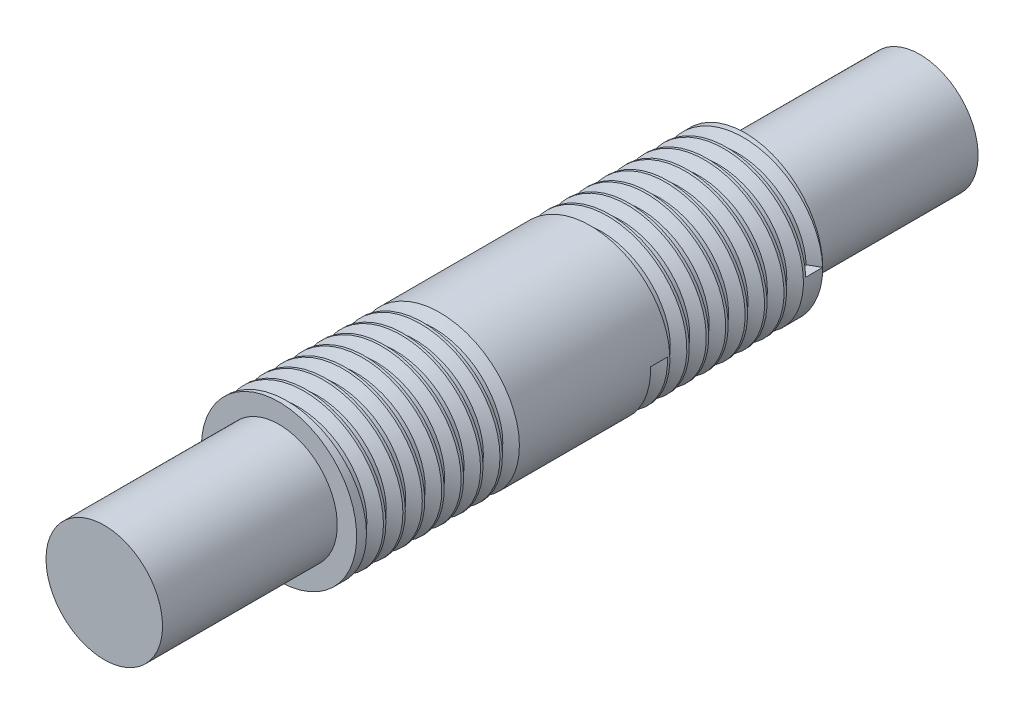
from build123d import *

# Parameters (mm, degrees)
SKETCH1_R           = 4
BOSS_EXTRUDE1_DEPTH = 12
SKETCH2_R           = 3
BOSS_EXTRUDE2_DEPTH = 21
THREAD1_PITCH       = 1
THREAD2_PITCH       = 1


with BuildPart() as part:
    # Sketch1 → Boss-Extrude1 (new, symmetric)
    with BuildSketch(Plane.XY):
        Circle(SKETCH1_R)
    extrude(amount=BOSS_EXTRUDE1_DEPTH, both=True)

    # Sketch2 → Boss-Extrude2 (add, symmetric)
    with BuildSketch(Plane.XY):
        with Locations(Location((0, 0, 0), (0, 0, 180))):
            Circle(SKETCH2_R)
    extrude(amount=BOSS_EXTRUDE2_DEPTH, both=True)

    # Thread1: the profile of Thread Profile1 profile screwed along a right-hand helix of 8 turns, 8 arcs to a turn; built about Z, then put on its axis
    thread1_z = Axis((0, 0, 0), (0, 0, 1))
    thread1_corners = [(4.0003, 0, -0.000173205), (4.0003, 0, 0.875173202), (3.458734125, 0, 0.562499999), (3.458734125, 0, 0.312499999)]
    with BuildLine(mode=Mode.PRIVATE) as thread1_profile:
        Line(thread1_corners[0], thread1_corners[1])
        Line(thread1_corners[1], thread1_corners[2])
        Line(thread1_corners[2], thread1_corners[3])
        Line(thread1_corners[3], thread1_corners[0])
    thread1_cap = Face(thread1_profile.wire())
    thread1_turn_angles = [0, 22.5, 45, 67.5, 90, 112.5, 135, 157.5, 180, 202.5, 225, 247.5, 270, 292.5, 315, 337.5, 360]
    thread1_turn_weights = [1, 0.9238795325112867, 1, 0.9238795325112867, 1, 0.9238795325112867, 1, 0.9238795325112867, 1, 0.9238795325112867, 1, 0.9238795325112867, 1, 0.9238795325112867, 1, 0.9238795325112867, 1]
    thread1_turn_rails = [Edge.make_bspline([Vector(p[0], p[1], 0).rotate(thread1_z, thread1_turn_angles[k]) / thread1_turn_weights[k] + Vector(0, 0, p[2] + THREAD1_PITCH * thread1_turn_angles[k] / 360) for k in range(17)], [0, 0, 0, 1, 1, 2, 2, 3, 3, 4, 4, 5, 5, 6, 6, 7, 7, 8, 8, 8], 2, thread1_turn_weights) for p in thread1_corners]
    thread1_turn_sides = [Face.make_surface_from_curves(thread1_turn_rails[p[0]], thread1_turn_rails[p[1]]) for p in [(0, 1), (1, 2), (2, 3), (3, 0)]]
    thread1 = Plane(origin=(0, 0, 12), x_dir=(-1, 0, 0), z_dir=(0, 0, -1)) * Solid(Shell([*[p.moved(Location((0, 0, THREAD1_PITCH * i))) for i in range(8) for p in thread1_turn_sides], thread1_cap, thread1_cap.rotate(thread1_z, 2880).moved(Location((0, 0, THREAD1_PITCH * 2880 / 360)))]))
    add(thread1, mode=Mode.SUBTRACT)

    # Thread2: the profile of Thread Profile2 profile screwed along a right-hand helix of 8 turns, 8 arcs to a turn; built about Z, then put on its axis
    thread2_z = Axis((0, 0, 0), (0, 0, 1))
    thread2_corners = [(4.0003, 0, -0.000173205), (4.0003, 0, 0.875173202), (3.458734125, 0, 0.562499999), (3.458734125, 0, 0.312499999)]
    with BuildLine(mode=Mode.PRIVATE) as thread2_profile:
        Line(thread2_corners[0], thread2_corners[1])
        Line(thread2_corners[1], thread2_corners[2])
        Line(thread2_corners[2], thread2_corners[3])
        Line(thread2_corners[3], thread2_corners[0])
    thread2_cap = Face(thread2_profile.wire())
    thread2_turn_angles = [0, 22.5, 45, 67.5, 90, 112.5, 135, 157.5, 180, 202.5, 225, 247.5, 270, 292.5, 315, 337.5, 360]
    thread2_turn_weights = [1, 0.9238795325112867, 1, 0.9238795325112867, 1, 0.9238795325112867, 1, 0.9238795325112867, 1, 0.9238795325112867, 1, 0.9238795325112867, 1, 0.9238795325112867, 1, 0.9238795325112867, 1]
    thread2_turn_rails = [Edge.make_bspline([Vector(p[0], p[1], 0).rotate(thread2_z, thread2_turn_angles[k]) / thread2_turn_weights[k] + Vector(0, 0, p[2] + THREAD2_PITCH * thread2_turn_angles[k] / 360) for k in range(17)], [0, 0, 0, 1, 1, 2, 2, 3, 3, 4, 4, 5, 5, 6, 6, 7, 7, 8, 8, 8], 2, thread2_turn_weights) for p in thread2_corners]
    thread2_turn_sides = [Face.make_surface_from_curves(thread2_turn_rails[p[0]], thread2_turn_rails[p[1]]) for p in [(0, 1), (1, 2), (2, 3), (3, 0)]]
    thread2 = Plane(origin=(0, 0, -12), x_dir=(1, 0, 0), z_dir=(0, 0, 1)) * Solid(Shell([*[p.moved(Location((0, 0, THREAD2_PITCH * i))) for i in range(8) for p in thread2_turn_sides], thread2_cap, thread2_cap.rotate(thread2_z, 2880).moved(Location((0, 0, THREAD2_PITCH * 2880 / 360)))]))
    add(thread2, mode=Mode.SUBTRACT)


solid = part.part
